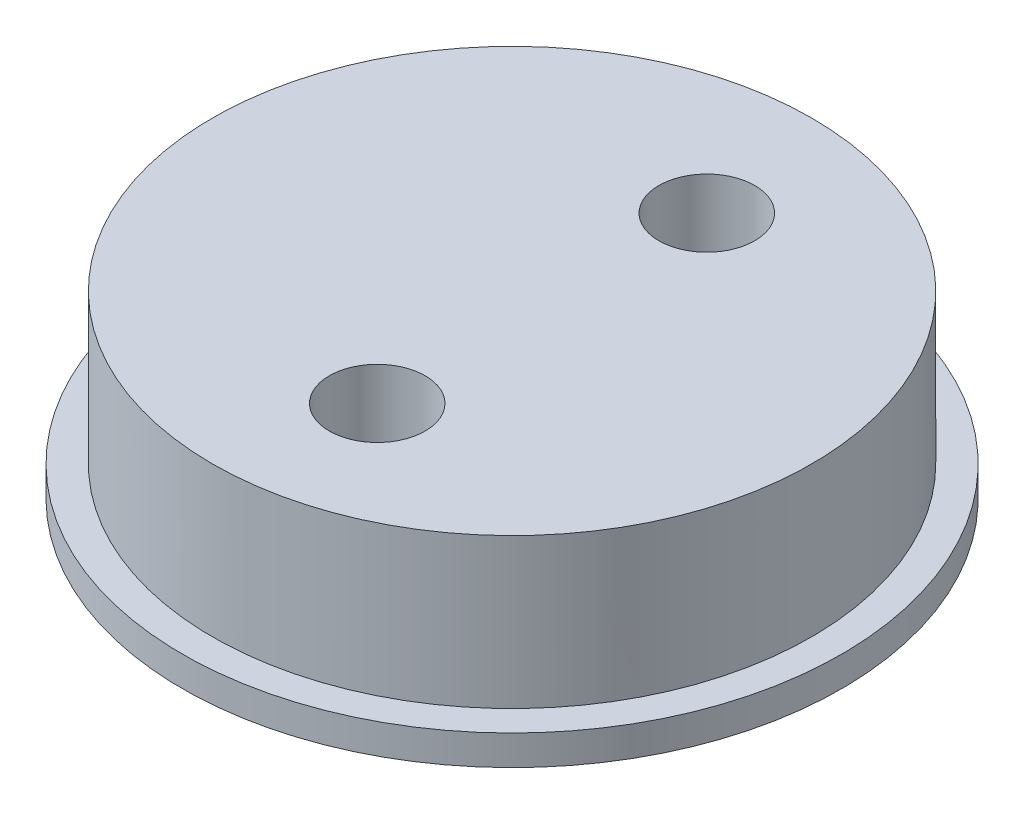
from build123d import *

# Parameters (mm, degrees)
SKETCH1_R           = 10
BOSS_EXTRUDE1_DEPTH = 6
SKETCH2_R           = 11
BOSS_EXTRUDE2_DEPTH = 1
SKETCH4_R           = 1.6
CUT_EXTRUDE1_DEPTH  = 18.349351573


with BuildPart() as part:
    # Sketch1 → Boss-Extrude1 (new body)
    with BuildSketch(Plane(origin=(0, 0, 0), x_dir=(1, 0, 0), z_dir=(0, 1, 0))):
        with Locations((-1, 0)):
            Circle(SKETCH1_R)
    extrude(amount=BOSS_EXTRUDE1_DEPTH)

    # Sketch2 → Boss-Extrude2 (add)
    with BuildSketch(Plane.XZ):
        with Locations((-1, 0)):
            Circle(SKETCH2_R)
    extrude(amount=-BOSS_EXTRUDE2_DEPTH)

    # Sketch4 → Cut-Extrude1 (cut, through all)
    with BuildSketch(Plane(origin=(0, 6, 0), x_dir=(1, 0, 0), z_dir=(0, 1, 0))):
        with Locations((0, 5.5)):
            Circle(SKETCH4_R)
        with Locations((0, -5.5)):
            Circle(SKETCH4_R)
    extrude(amount=-CUT_EXTRUDE1_DEPTH, mode=Mode.SUBTRACT)


solid = part.part
